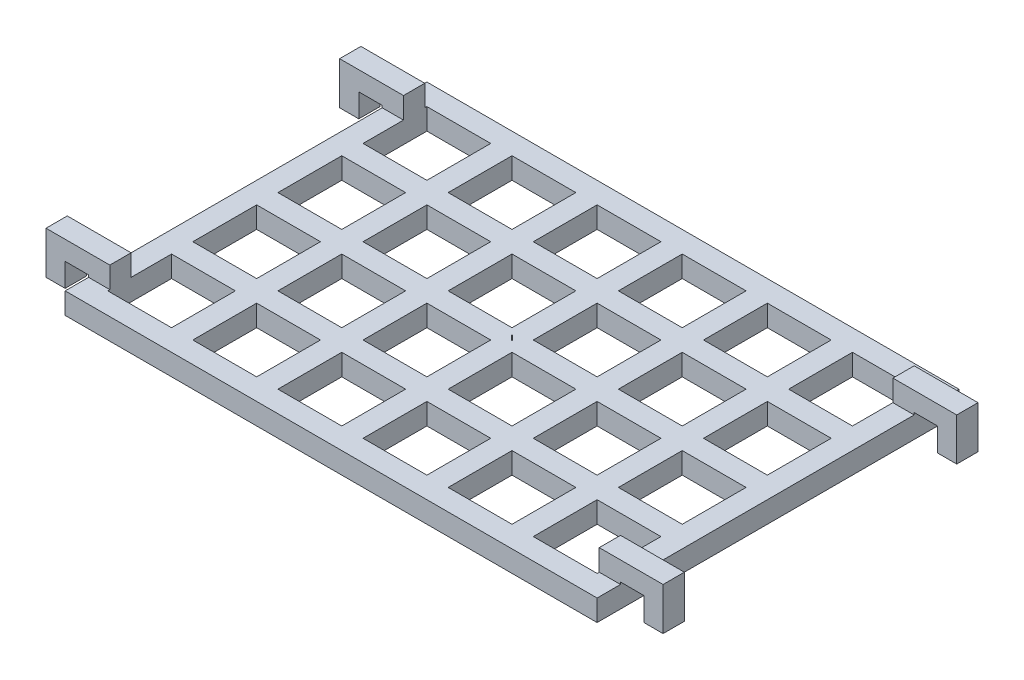
from build123d import *

# Parameters (mm, degrees)
SKETCH_1_W                     = 125
SKETCH_1_H                     = 85
EXTRUDE_1_DEPTH                = 5
SKETCH_2_W                     = 15
SKETCH_2_H                     = 15
CUT_EXTRUDE_1_DEPTH            = 5
PATTERN_LINEAR_1_COUNT         = 6
PATTERN_LINEAR_1_PITCH         = 20
PATTERN_LINEAR_1_COUNT_DIR2    = 4
PATTERN_LINEAR_1_PITCH_DIR2    = 20
EXTRUDE_START                  = -5
SKETCH_3_W                     = 5
SKETCH_3_H                     = 10
EXTRUDE_2_DEPTH                = 15
PATTERN_LINEAR_2_COUNT         = 2
PATTERN_LINEAR_2_PITCH         = 69
CUT_EXTRUDE_START              = -15
SKETCH_5_W                     = 5.5
SKETCH_5_H                     = 5.5
CUT_EXTRUDE_3_DEPTH            = 125
SKETCH_9_R                     = 0.1
EXTRUDE_3_DEPTH                = 1
PATTERN_CIRCULAR_1_OUTLINE_W   = 4.5
PATTERN_CIRCULAR_1_OUTLINE_H   = 5
PATTERN_CIRCULAR_1_OUTLINE_W_2 = 5
PATTERN_CIRCULAR_1_DEPTH       = 10
PATTERN_START                  = 5.5
PATTERN_CIRCULAR_1_2_OUTLINE_W = 5.5
PATTERN_CIRCULAR_1_2_OUTLINE_H = 5
PATTERN_CIRCULAR_1_2_DEPTH     = 4.5


# Read off the part's stored shape, not the designer's step: 阵列(圆周)1
with BuildPart() as part:
    # 草图1 → 凸台-拉伸1 (new body)
    with BuildSketch(Plane(origin=(0, 0, 0), x_dir=(1, 0, 0), z_dir=(0, 1, 0))):
        with Locations((62.5, -42.5)):
            Rectangle(SKETCH_1_W, SKETCH_1_H)
    extrude(amount=EXTRUDE_1_DEPTH)

    # 草图2 → 切除-拉伸1 (cut)
    with BuildSketch(Plane(origin=(0, 5, 0), x_dir=(1, 0, 0), z_dir=(0, 1, 0))):
        with Locations((12.5, -12.5)):
            Rectangle(SKETCH_2_W, SKETCH_2_H)
    cut_extrude_1 = extrude(amount=-CUT_EXTRUDE_1_DEPTH, mode=Mode.SUBTRACT)

    # 阵列(线性)1: Cut-Extrude 1 6 × 4
    with Locations(*[(i * PATTERN_LINEAR_1_PITCH, 0, j * PATTERN_LINEAR_1_PITCH_DIR2) for i in range(PATTERN_LINEAR_1_COUNT) for j in range(PATTERN_LINEAR_1_COUNT_DIR2) if (i, j) != (0, 0)]):
        add(cut_extrude_1, mode=Mode.SUBTRACT)

    # 草图3 → 凸台-拉伸2 (add)
    with BuildSketch(Plane(origin=(125, 0, 0), x_dir=(0, 0, -1), z_dir=(1, 0, 0)).offset(EXTRUDE_START)):
        with Locations((-8, 5)):
            Rectangle(SKETCH_3_W, SKETCH_3_H)
    extrude_2 = extrude(amount=EXTRUDE_2_DEPTH)

    # 阵列(线性)2: 凸台-拉伸2 ×2
    with Locations(*[(0, 0, i * PATTERN_LINEAR_2_PITCH) for i in range(1, PATTERN_LINEAR_2_COUNT)]):
        add(extrude_2)

    # 草图5 → 切除-拉伸3 (cut)
    with BuildSketch(Plane.XY.offset(10.5).offset(CUT_EXTRUDE_START)):
        with Locations((127.75, 2.75)):
            Rectangle(SKETCH_5_W, SKETCH_5_H)
    extrude(amount=CUT_EXTRUDE_3_DEPTH, mode=Mode.SUBTRACT)

    # 草图9 → 凸台-拉伸3 (add)
    with BuildSketch(Plane(origin=(0, 5, 0), x_dir=(1, 0, 0), z_dir=(0, 1, 0))):
        with Locations(Location((62.5, -42.5, 0), (0, 0, 270))):
            Circle(SKETCH_9_R)
    extrude(amount=EXTRUDE_3_DEPTH)

    # 阵列(圆周)1 outline → 阵列(圆周)1 (add)
    with BuildSketch(Plane(origin=(0, 0, 0), x_dir=(1, 0, 0), z_dir=(0, 1, 0))):
        with Locations((-7.75, -77)):
            Rectangle(PATTERN_CIRCULAR_1_OUTLINE_W, PATTERN_CIRCULAR_1_OUTLINE_H)
        with Locations((2.5, -8)):
            Rectangle(PATTERN_CIRCULAR_1_OUTLINE_W_2, PATTERN_CIRCULAR_1_OUTLINE_H)
        with Locations((2.5, -77)):
            Rectangle(PATTERN_CIRCULAR_1_OUTLINE_W_2, PATTERN_CIRCULAR_1_OUTLINE_H)
        with Locations((-7.75, -8)):
            Rectangle(PATTERN_CIRCULAR_1_OUTLINE_W, PATTERN_CIRCULAR_1_OUTLINE_H)
    extrude(amount=PATTERN_CIRCULAR_1_DEPTH)

    # Pattern Circular 1 2 outline → Pattern Circular 1 2 (add)
    with BuildSketch(Plane(origin=(0, 0, 0), x_dir=(1, 0, 0), z_dir=(0, 1, 0)).offset(PATTERN_START)):
        with Locations((-2.75, -8)):
            Rectangle(PATTERN_CIRCULAR_1_2_OUTLINE_W, PATTERN_CIRCULAR_1_2_OUTLINE_H)
        with Locations((-2.75, -77)):
            Rectangle(PATTERN_CIRCULAR_1_2_OUTLINE_W, PATTERN_CIRCULAR_1_2_OUTLINE_H)
    extrude(amount=PATTERN_CIRCULAR_1_2_DEPTH)


solid = part.part
